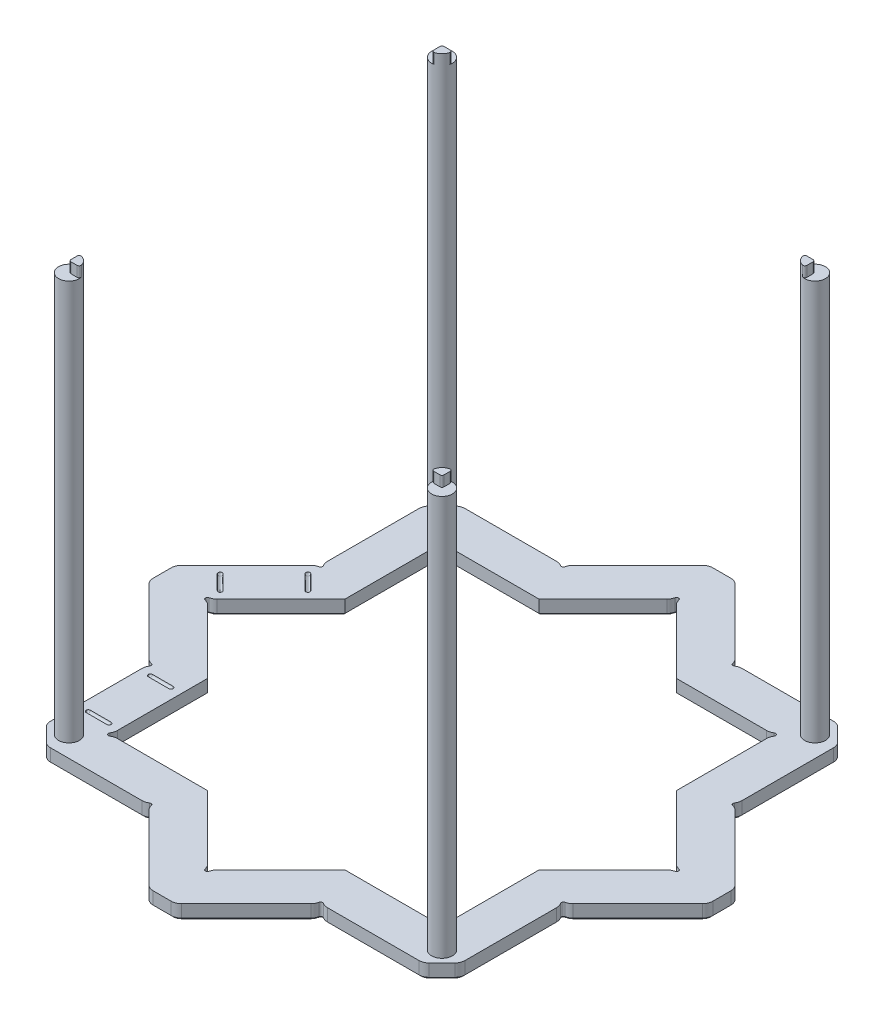
from build123d import *
from build123d.topology import SkipClean

# Parameters (mm, degrees)
SKETCH_1_W                       = 100
SKETCH_1_H                       = 100
EXTRUDE_1_DEPTH                  = 3.5
CUT_EXTRUDE_1_DEPTH              = 13.5
FILLET_1_R                       = 2.5
SKETCH_3_W                       = 80
SKETCH_3_H                       = 80
CUT_EXTRUDE_2_DEPTH              = 13.5
SKETCH_5_R                       = 0.5
CUT_EXTRUDE_3_DEPTH              = 13.5
FILLET_2_R                       = 2.5
SKETCH_13_R                      = 2.5
EXTRUDE_5_DEPTH                  = 96.5
EXTRUDE_6_DEPTH                  = 2.5
FILLET_7_R                       = 0.5
CUT_EXTRUDE_8_DEPTH              = 0.5
CUT_EXTRUDE_9_DEPTH              = 10
FILLET_8_R                       = 2.5
CHAMFER_1_SIZE                   = 0.5
SKETCH_19_W                      = 6
SKETCH_19_H                      = 1
CUT_EXTRUDE_10_DEPTH             = 0.5
FILLET_9_R                       = 0.5
SKETCH_20_R                      = 9.729268333
EXTRUDE_7_DEPTH                  = 10.5
PATTERN_CIRCULAR_1_COUNT         = 2
PATTERN_CIRCULAR_1_ANGLE         = 45
FILLET_9_OF_PATTERN_CIRCULAR_1_R = 0.5
SKETCH_21_R                      = 9.729268333
CUT_EXTRUDE_11_DEPTH             = 10.5


with BuildPart() as part:
    # 草图1 → 凸台-拉伸1 (new body)
    with BuildSketch(Plane(origin=(0, 0, 0), x_dir=(1, 0, 0), z_dir=(0, 1, 0))):
        Polygon((-20.710678119, 50), (20.710678119, 50), (0, 70.710678119), align=None)
        Polygon((20.710678119, 50), (50, 20.710678119), (50, 50), align=None)
        Polygon((50, -20.710678119), (70.710678119, 0), (50, 20.710678119), align=None)
        Polygon((0, -70.710678119), (20.710678119, -50), (-20.710678119, -50), align=None)
        Polygon((50, -50), (50, -20.710678119), (20.710678119, -50), align=None)
        Polygon((-50, -50), (-20.710678119, -50), (-50, -20.710678119), align=None)
        Polygon((-50, -20.710678119), (-50, 20.710678119), (-70.710678119, 0), align=None)
        Polygon((-50, 20.710678119), (-20.710678119, 50), (-50, 50), align=None)
        Polygon((0, -70.710678119), (-70.710678119, 0), (0, 70.710678119), (70.710678119, 0), align=None)
        Rectangle(SKETCH_1_W, SKETCH_1_H)
    extrude(amount=EXTRUDE_1_DEPTH)

    # 草图2 → 切除-拉伸1 (cut)
    with BuildSketch(Plane(origin=(0, 3.5, 0), x_dir=(1, 0, 0), z_dir=(0, 1, 0))):
        Polygon((45.45941546, 50), (50, 45.45941546), (50, 50), align=None)
        Polygon((-50, 50), (-50, 45.45941546), (-45.45941546, 50), align=None)
        Polygon((-50, -50), (-45.45941546, -50), (-50, -45.45941546), align=None)
        Polygon((50, -45.45941546), (45.45941546, -50), (50, -50), align=None)
        Polygon((67.5, 3.210678119), (67.5, -3.210678119), (70.710678119, 0), align=None)
        Polygon((0, -70.710678119), (3.210678119, -67.5), (-3.210678119, -67.5), align=None)
        Polygon((-70.710678119, 0), (-67.5, -3.210678119), (-67.5, 3.210678119), align=None)
        Polygon((-50, 50), (-50, 45.45941546), (-45.45941546, 50), align=None)
        Polygon((-50, -50), (-45.45941546, -50), (-50, -45.45941546), align=None)
        Polygon((-3.210678119, 67.5), (3.210678119, 67.5), (0, 70.710678119), align=None)
        Polygon((45.45941546, 50), (50, 45.45941546), (50, 50), align=None)
    extrude(amount=-CUT_EXTRUDE_1_DEPTH, mode=Mode.SUBTRACT)

    # 圆角1
    fillet_1_edges = [part.edges().sort_by_distance(p)[0] for p in [
        (50, 1.75, -45.45941546),
        (45.45941546, 1.75, -50),
        (-3.210678119, 1.75, -67.5),
        (3.210678119, 1.75, -67.5),
        (-45.45941546, 1.75, 50),
        (-50, 1.75, 45.45941546),
        (-45.45941546, 1.75, -50),
        (-50, 1.75, -45.45941546),
        (-67.5, 1.75, 3.210678119),
        (-67.5, 1.75, -3.210678119),
        (3.210678119, 1.75, 67.5),
        (-3.210678119, 1.75, 67.5),
        (67.5, 1.75, -3.210678119),
        (67.5, 1.75, 3.210678119),
        (45.45941546, 1.75, 50),
        (50, 1.75, 45.45941546),
    ]]
    fillet(fillet_1_edges, radius=FILLET_1_R)

    # 草图3 → 切除-拉伸2 (cut)
    with BuildSketch(Plane(origin=(0, 3.5, 0), x_dir=(1, 0, 0), z_dir=(0, 1, 0))):
        Rectangle(SKETCH_3_W, SKETCH_3_H)
        Polygon((56.568542495, 0), (0, 56.568542495), (-56.568542495, 0), (0, -56.568542495), align=None)
        Polygon((40, 16.568542495), (40, -16.568542495), (56.568542495, 0), align=None)
        Polygon((16.568542495, 40), (40, 16.568542495), (40, 40), align=None)
        Polygon((-16.568542495, 40), (16.568542495, 40), (0, 56.568542495), align=None)
        Polygon((-40, 40), (-40, 16.568542495), (-16.568542495, 40), align=None)
        Polygon((-56.568542495, 0), (-40, -16.568542495), (-40, 16.568542495), align=None)
        Polygon((-40, -40), (-16.568542495, -40), (-40, -16.568542495), align=None)
        Polygon((-16.568542495, -40), (0, -56.568542495), (16.568542495, -40), align=None)
        Polygon((40, -16.568542495), (16.568542495, -40), (40, -40), align=None)
    extrude(amount=-CUT_EXTRUDE_2_DEPTH, mode=Mode.SUBTRACT)

    # 草图5 → 切除-拉伸3 (cut)
    with BuildSketch(Plane(origin=(0, 3.5, 0), x_dir=(1, 0, 0), z_dir=(0, 1, 0))):
        with BuildLine():
            Line((40, -40), (39.5, -40))
            ThreePointArc((39.5, -40), (40, -40.5), (40.5, -40))
            ThreePointArc((40.5, -40), (40.353553391, -39.646446609), (40, -39.5))
            Line((40, -39.5), (40, -40))
        make_face()
        with BuildLine():
            ThreePointArc((-40, -39.5), (-40.353553391, -40.353553391), (-39.5, -40))
            Line((-39.5, -40), (-40, -40))
            Line((-40, -40), (-40, -39.5))
        make_face()
        with BuildLine():
            ThreePointArc((-39.5, 40), (-40.353553391, 40.353553391), (-40, 39.5))
            Line((-40, 39.5), (-40, 40))
            Line((-40, 40), (-39.5, 40))
        make_face()
        with BuildLine():
            Line((40, 40), (40, 39.5))
            ThreePointArc((40, 39.5), (40.353553391, 39.646446609), (40.5, 40))
            ThreePointArc((40.5, 40), (40, 40.5), (39.5, 40))
            Line((39.5, 40), (40, 40))
        make_face()
        with Locations((56.568542495, 0)):
            Circle(SKETCH_5_R)
        with Locations((0, -56.568542495)):
            Circle(SKETCH_5_R)
        with Locations((-56.568542495, 0)):
            Circle(SKETCH_5_R)
        with Locations((0, 56.568542495)):
            Circle(SKETCH_5_R)
    extrude(amount=-CUT_EXTRUDE_3_DEPTH, mode=Mode.SUBTRACT)

    # 圆角2
    fillet_2_edges = [part.edges().sort_by_distance(p)[0] for p in [
        (56.214989104, 1.75, 0.353553391),
        (40, 1.75, -39.5),
        (0.353553391, 1.75, -56.214989104),
        (-39.5, 1.75, -40),
        (-56.214989104, 1.75, -0.353553391),
        (-40, 1.75, 39.5),
        (-0.353553391, 1.75, 56.214989104),
        (39.5, 1.75, 40),
        (-39.5, 1.75, 40),
        (-40, 1.75, -39.5),
        (39.5, 1.75, -40),
        (56.214989104, 1.75, -0.353553391),
        (0.353553391, 1.75, 56.214989104),
        (-56.214989104, 1.75, 0.353553391),
        (-0.353553391, 1.75, -56.214989104),
        (40, 1.75, 39.5),
    ]]
    fillet(fillet_2_edges, radius=FILLET_2_R)

    # 草图13 → 凸台-拉伸5 (add)
    with BuildSketch(Plane(origin=(0, 3.5, 0), x_dir=(1, 0, 0), z_dir=(0, 1, 0))):
        with Locations(Location((-45, -45, 0), (0, 0, 270))):
            Circle(SKETCH_13_R)
        with Locations(Location((45, -45, 0), (0, 0, 270))):
            Circle(SKETCH_13_R)
        with Locations(Location((45, 45, 0), (0, 0, 270))):
            Circle(SKETCH_13_R)
        with Locations(Location((-45, 45, 0), (0, 0, 270))):
            Circle(SKETCH_13_R)
    extrude(amount=EXTRUDE_5_DEPTH)

    # 草图14 → 凸台-拉伸6 (add)
    with SkipClean():  # the faces are left unmerged after this step: merging them gives an invalid solid
        with BuildSketch(Plane(origin=(0, 100, 0), x_dir=(1, 0, 0), z_dir=(0, 1, 0))):
            with BuildLine():
                ThreePointArc((-45, 42.5), (-43.232233047, 43.232233047), (-42.5, 45))
                Line((-42.5, 45), (-45, 45))
                Line((-45, 45), (-45, 42.5))
            make_face()
            with BuildLine():
                Line((45, 45), (42.5, 45))
                ThreePointArc((42.5, 45), (43.232233047, 43.232233047), (45, 42.5))
                Line((45, 42.5), (45, 45))
            make_face()
            with BuildLine():
                ThreePointArc((-42.5, -45), (-43.232233047, -43.232233047), (-45, -42.5))
                Line((-45, -42.5), (-45, -45))
                Line((-45, -45), (-42.5, -45))
            make_face()
            with BuildLine():
                Line((45, -45), (45, -42.5))
                ThreePointArc((45, -42.5), (43.232233047, -43.232233047), (42.5, -45))
                Line((42.5, -45), (45, -45))
            make_face()
        extrude(amount=EXTRUDE_6_DEPTH)

    # 圆角7
    # the kernel refuses this fillet: 0.5 mm, written as the material it takes off along each edge
    with BuildSketch(Plane(origin=(45, 100, 45), x_dir=(-1, 0, 0), z_dir=(0, 1, 0)), Plane(origin=(-45, 100, 45), x_dir=(0, 0, -1), z_dir=(0, 1, 0)), Plane(origin=(-45, 100, -45), x_dir=(1, 0, 0), z_dir=(0, 1, 0))) as fillet_7_piece_1:
        with BuildLine():
            CenterArc((FILLET_7_R, -FILLET_7_R), FILLET_7_R, 90, 90)
            Line((0, -FILLET_7_R), (0, 0))
            Line((0, 0), (FILLET_7_R, 0))
        make_face()
    extrude(amount=3.75, mode=Mode.SUBTRACT)
    with BuildSketch(Plane(origin=(45, 100, 42.5), x_dir=(-0.992029696267168, 0, 0.12600429248271836), z_dir=(0, 1, 0)), Plane(origin=(-42.5, 100, 45), x_dir=(-0.12600429248272402, 0, -0.9920296962671673), z_dir=(0, 1, 0)), Plane(origin=(-45, 100, -42.5), x_dir=(0.992029696267167, 0, -0.12600429248272682), z_dir=(0, 1, 0)), Plane(origin=(42.5, 100, -45), x_dir=(0.12600429248273368, 0, 0.992029696267166), z_dir=(0, 1, 0))) as fillet_7_piece_2:
        with BuildLine():
            CenterArc((0.567019316, 0.496014848), FILLET_7_R, 172.761243907, 104.477512186)
            Line((0.071004468, 0.559016994), (0, 0))
            ThreePointArc((0, 0), (0.315010731, -0.019925759), (0.630021462, 0))
        make_face()
    extrude(amount=4.075053656, mode=Mode.SUBTRACT)
    with BuildSketch(Plane(origin=(42.5, 100, 45), x_dir=(0.1260042924827351, 0, -0.9920296962671659), z_dir=(0, 1, 0)), Plane(origin=(-45, 100, 42.5), x_dir=(0.992029696267167, 0, 0.12600429248272682), z_dir=(0, 1, 0)), Plane(origin=(-42.5, 100, -45), x_dir=(-0.12600429248272402, 0, 0.9920296962671673), z_dir=(0, 1, 0)), Plane(origin=(45, 100, -42.5), x_dir=(-0.9920296962671677, 0, -0.12600429248271977), z_dir=(0, 1, 0))) as fillet_7_piece_3:
        with BuildLine():
            CenterArc((0.567019316, -0.496014848), FILLET_7_R, 82.761243907, 104.477512186)
            Line((0.071004468, -0.559016994), (0, 0))
            ThreePointArc((0, 0), (0.315010731, 0.019925759), (0.630021462, 0))
        make_face()
    extrude(amount=4.075053656, mode=Mode.SUBTRACT)
    with BuildSketch(Plane(origin=(45, 100, -45), x_dir=(-1, 0, 0), z_dir=(0, 1, 0))) as fillet_7_piece_4:
        with BuildLine():
            CenterArc((FILLET_7_R, FILLET_7_R), FILLET_7_R, 180, 90)
            Line((0, FILLET_7_R), (0, 0))
            Line((0, 0), (FILLET_7_R, 0))
        make_face()
    extrude(amount=3.75, mode=Mode.SUBTRACT)

    # 草图15 → 切除-拉伸8 (cut)
    with BuildSketch(Plane.XZ):
        with BuildLine():
            ThreePointArc((42.5, 45), (42.512659617, 44.748727595), (42.550510257, 44.5))
            Line((42.550510257, 44.5), (44.5, 44.5))
            Line((44.5, 44.5), (44.5, 42.550510257))
            ThreePointArc((44.5, 42.550510257), (44.748727595, 42.512659617), (45, 42.5))
            Line((45, 42.5), (45, 45))
            Line((45, 45), (42.5, 45))
        make_face()
        with BuildLine():
            Line((44.5, -44.5), (42.550510257, -44.5))
            ThreePointArc((42.550510257, -44.5), (42.512659617, -44.748727595), (42.5, -45))
            Line((42.5, -45), (45, -45))
            Line((45, -45), (45, -42.5))
            ThreePointArc((45, -42.5), (44.748727595, -42.512659617), (44.5, -42.550510257))
            Line((44.5, -42.550510257), (44.5, -44.5))
        make_face()
        with BuildLine():
            Line((-42.550510257, -44.5), (-44.5, -44.5))
            Line((-44.5, -44.5), (-44.5, -42.550510257))
            ThreePointArc((-44.5, -42.550510257), (-44.748727595, -42.512659617), (-45, -42.5))
            Line((-45, -42.5), (-45, -45))
            Line((-45, -45), (-42.5, -45))
            ThreePointArc((-42.5, -45), (-42.512659617, -44.748727595), (-42.550510257, -44.5))
        make_face()
        with BuildLine():
            ThreePointArc((-45, 42.5), (-44.748727595, 42.512659617), (-44.5, 42.550510257))
            Line((-44.5, 42.550510257), (-44.5, 44.5))
            Line((-44.5, 44.5), (-42.550510257, 44.5))
            ThreePointArc((-42.550510257, 44.5), (-42.512659617, 44.748727595), (-42.5, 45))
            Line((-42.5, 45), (-45, 45))
            Line((-45, 45), (-45, 42.5))
        make_face()
    extrude(amount=-CUT_EXTRUDE_8_DEPTH, mode=Mode.SUBTRACT)

    # 草图18 → 切除-拉伸9 (cut)
    with BuildSketch(Plane(origin=(0, 3.5, 0), x_dir=(1, 0, 0), z_dir=(0, 1, 0))):
        with BuildLine():
            ThreePointArc((50.5, 20.710678119), (50.353553391, 21.064231509), (50, 21.210678119))
            Line((50, 21.210678119), (50, 20.710678119))
            Line((50, 20.710678119), (50.353553391, 20.357124728))
            ThreePointArc((50.353553391, 20.357124728), (50.461939766, 20.519336402), (50.5, 20.710678119))
        make_face()
        with BuildLine():
            Line((50, 20.710678119), (50, 21.210678119))
            ThreePointArc((50, 21.210678119), (49.538060234, 20.519336402), (50.353553391, 20.357124728))
            Line((50.353553391, 20.357124728), (50, 20.710678119))
        make_face()
        with BuildLine():
            ThreePointArc((50.5, -20.710678119), (50.461939766, -20.519336402), (50.353553391, -20.357124728))
            Line((50.353553391, -20.357124728), (50, -20.710678119))
            Line((50, -20.710678119), (50, -21.210678119))
            ThreePointArc((50, -21.210678119), (50.353553391, -21.064231509), (50.5, -20.710678119))
        make_face()
        with BuildLine():
            Line((50, -20.710678119), (50.353553391, -20.357124728))
            ThreePointArc((50.353553391, -20.357124728), (49.538060234, -20.519336402), (50, -21.210678119))
            Line((50, -21.210678119), (50, -20.710678119))
        make_face()
        with BuildLine():
            ThreePointArc((20.357124728, -50.353553391), (20.902019835, -50.461939766), (21.210678119, -50))
            Line((21.210678119, -50), (20.710678119, -50))
            Line((20.710678119, -50), (20.357124728, -50.353553391))
        make_face()
        with BuildLine():
            Line((20.710678119, -50), (21.210678119, -50))
            ThreePointArc((21.210678119, -50), (20.519336402, -49.538060234), (20.357124728, -50.353553391))
            Line((20.357124728, -50.353553391), (20.710678119, -50))
        make_face()
        with BuildLine():
            ThreePointArc((-20.210678119, -50), (-20.710678119, -49.5), (-21.210678119, -50))
            Line((-21.210678119, -50), (-20.710678119, -50))
            Line((-20.710678119, -50), (-20.357124728, -50.353553391))
            ThreePointArc((-20.357124728, -50.353553391), (-20.248738352, -50.191341716), (-20.210678119, -50))
        make_face()
        with BuildLine():
            Line((-20.710678119, -50), (-21.210678119, -50))
            ThreePointArc((-21.210678119, -50), (-20.902019835, -50.461939766), (-20.357124728, -50.353553391))
            Line((-20.357124728, -50.353553391), (-20.710678119, -50))
        make_face()
        with BuildLine():
            ThreePointArc((-49.5, -20.710678119), (-49.808658284, -20.248738352), (-50.353553391, -20.357124728))
            Line((-50.353553391, -20.357124728), (-50, -20.710678119))
            Line((-50, -20.710678119), (-50, -21.210678119))
            ThreePointArc((-50, -21.210678119), (-49.646446609, -21.064231509), (-49.5, -20.710678119))
        make_face()
        with BuildLine():
            Line((-50, -20.710678119), (-50.353553391, -20.357124728))
            ThreePointArc((-50.353553391, -20.357124728), (-50.461939766, -20.902019835), (-50, -21.210678119))
            Line((-50, -21.210678119), (-50, -20.710678119))
        make_face()
        with BuildLine():
            ThreePointArc((-49.5, 20.710678119), (-49.646446609, 21.064231509), (-50, 21.210678119))
            Line((-50, 21.210678119), (-50, 20.710678119))
            Line((-50, 20.710678119), (-50.353553391, 20.357124728))
            ThreePointArc((-50.353553391, 20.357124728), (-49.808658284, 20.248738352), (-49.5, 20.710678119))
        make_face()
        with BuildLine():
            Line((-50, 20.710678119), (-50, 21.210678119))
            ThreePointArc((-50, 21.210678119), (-50.461939766, 20.902019835), (-50.353553391, 20.357124728))
            Line((-50.353553391, 20.357124728), (-50, 20.710678119))
        make_face()
        with BuildLine():
            ThreePointArc((-20.210678119, 50), (-20.248738352, 50.191341716), (-20.357124728, 50.353553391))
            Line((-20.357124728, 50.353553391), (-20.710678119, 50))
            Line((-20.710678119, 50), (-21.210678119, 50))
            ThreePointArc((-21.210678119, 50), (-20.710678119, 49.5), (-20.210678119, 50))
        make_face()
        with BuildLine():
            Line((-20.710678119, 50), (-20.357124728, 50.353553391))
            ThreePointArc((-20.357124728, 50.353553391), (-20.902019835, 50.461939766), (-21.210678119, 50))
            Line((-21.210678119, 50), (-20.710678119, 50))
        make_face()
        with BuildLine():
            Line((21.210678119, 50), (20.710678119, 50))
            Line((20.710678119, 50), (20.357124728, 50.353553391))
            ThreePointArc((20.357124728, 50.353553391), (20.519336402, 49.538060234), (21.210678119, 50))
        make_face()
        with BuildLine():
            Line((20.357124728, 50.353553391), (20.710678119, 50))
            Line((20.710678119, 50), (21.210678119, 50))
            ThreePointArc((21.210678119, 50), (20.902019835, 50.461939766), (20.357124728, 50.353553391))
        make_face()
    extrude(amount=-CUT_EXTRUDE_9_DEPTH, mode=Mode.SUBTRACT)

    # 圆角8
    fillet_8_edges = [part.edges().sort_by_distance(p)[0] for p in [
        (21.210678119, 1.75, -50),
        (50, 1.75, -21.210678119),
        (50.353553391, 1.75, 20.357124728),
        (20.357124728, 1.75, 50.353553391),
        (-20.357124728, 1.75, 50.353553391),
        (-50, 1.75, 21.210678119),
        (-50.353553391, 1.75, -20.357124728),
        (-21.210678119, 1.75, -50),
        (20.357124728, 1.75, -50.353553391),
        (-20.357124728, 1.75, -50.353553391),
        (-50, 1.75, -21.210678119),
        (-50.353553391, 1.75, 20.357124728),
        (-21.210678119, 1.75, 50),
        (21.210678119, 1.75, 50),
        (50, 1.75, 21.210678119),
        (50.353553391, 1.75, -20.357124728),
    ]]
    fillet(fillet_8_edges, radius=FILLET_8_R)

    # 倒角1
    chamfer_1_edges = [part.edges().sort_by_distance(p)[0] for p in [
        (49.538060234, 0, -20.519336402),
        (11.740492672, 0, -58.970185446),
        (20.519336402, 0, -49.538060234),
        (33.396436034, 0, -50),
        (49.538060234, 0, 20.519336402),
        (50, 0, 33.396436034),
        (33.396436034, 0, 50),
        (20.519336402, 0, 49.538060234),
        (11.740492672, 0, 58.970185446),
        (-20.519336402, 0, 49.538060234),
        (-50, 0, 33.396436034),
        (-49.538060234, 0, 20.519336402),
        (-58.970185446, 0, 11.740492672),
        (-58.970185446, 0, -11.740492672),
        (-49.538060234, 0, -20.519336402),
        (-20.519336402, 0, -49.538060234),
        (50.587034625, 0, 19.97312559),
        (49.893567769, 0, 21.647302677),
        (21.647302677, 0, 49.893567769),
        (19.97312559, 0, 50.587034625),
        (-19.97312559, 0, 50.587034625),
        (-21.647302677, 0, 49.893567769),
        (-49.893567769, 0, 21.647302677),
        (-50.587034625, 0, 19.97312559),
        (-49.893567769, 0, -21.647302677),
        (-50.587034625, 0, -19.97312559),
        (-21.647302677, 0, -49.893567769),
        (-19.97312559, 0, -50.587034625),
        (19.97312559, 0, -50.587034625),
        (21.647302677, 0, -49.893567769),
        (49.893567769, 0, -21.647302677),
        (50.587034625, 0, -19.97312559),
        (0, 0, -67.5),
        (47.72970773, 0, -47.72970773),
        (50, 0, -33.396436034),
        (58.970185446, 0, -11.740492672),
        (67.5, 0, 0),
        (58.970185446, 0, 11.740492672),
        (47.72970773, 0, 47.72970773),
        (0, 0, 67.5),
        (-11.740492672, 0, 58.970185446),
        (-33.396436034, 0, 50),
        (-47.72970773, 0, 47.72970773),
        (-67.5, 0, 0),
        (-50, 0, -33.396436034),
        (-47.72970773, 0, -47.72970773),
        (-33.396436034, 0, -50),
        (-11.740492672, 0, -58.970185446),
        (-45.380590135, 0, -49.809698831),
        (-49.809698831, 0, -45.380590135),
        (-45.380590135, 0, 49.809698831),
        (-49.809698831, 0, 45.380590135),
        (49.809698831, 0, 45.380590135),
        (45.380590135, 0, 49.809698831),
        (49.809698831, 0, -45.380590135),
        (45.380590135, 0, -49.809698831),
        (67.309698831, 0, -3.131852794),
        (67.309698831, 0, 3.131852794),
        (3.131852794, 0, 67.309698831),
        (-3.131852794, 0, 67.309698831),
        (-67.309698831, 0, 3.131852794),
        (-67.309698831, 0, -3.131852794),
        (-3.131852794, 0, -67.309698831),
        (3.131852794, 0, -67.309698831),
        (47.697969277, 0, 8.870573217),
        (40, 0, -27.45511505),
        (8.870573217, 0, -47.697969277),
        (-27.45511505, 0, -40),
        (-40, 0, -27.45511505),
        (-47.697969277, 0, -8.870573217),
        (-27.45511505, 0, 40),
        (-8.870573217, 0, 47.697969277),
        (-40, 0, 27.45511505),
        (-40.353553391, 0, 40.353553391),
        (0, 0, 57.068542495),
        (8.870573217, 0, 47.697969277),
        (27.45511505, 0, 40),
        (40.353553391, 0, 40.353553391),
        (40, 0, 27.45511505),
        (57.068542495, 0, 0),
        (47.697969277, 0, -8.870573217),
        (40.353553391, 0, -40.353553391),
        (27.45511505, 0, -40),
        (0, 0, -57.068542495),
        (-8.870573217, 0, -47.697969277),
        (-40.353553391, 0, -40.353553391),
        (-57.068542495, 0, 0),
        (-47.697969277, 0, 8.870573217),
        (40.106432231, 0, 39.063375441),
        (39.063375441, 0, 40.106432231),
        (40.106432231, 0, -39.063375441),
        (39.063375441, 0, -40.106432231),
        (-39.063375441, 0, -40.106432231),
        (-40.106432231, 0, -39.063375441),
        (-39.063375441, 0, 40.106432231),
        (-40.106432231, 0, 39.063375441),
        (0.737552529, 0, 55.98150787),
        (-0.737552529, 0, 55.98150787),
        (-0.737552529, 0, -55.98150787),
        (0.737552529, 0, -55.98150787),
        (55.98150787, 0, -0.737552529),
        (55.98150787, 0, 0.737552529),
        (-55.98150787, 0, 0.737552529),
        (-55.98150787, 0, -0.737552529),
    ]]
    chamfer(chamfer_1_edges, length=CHAMFER_1_SIZE)

    # 草图19 → 切除-拉伸10 (cut)
    with BuildSketch(Plane(origin=(0, 3.5, 0), x_dir=(1, 0, 0), z_dir=(0, 1, 0))):
        with Locations((-45, -37.841687605)):
            Rectangle(SKETCH_19_W, SKETCH_19_H)
        with Locations((-45, -22.868990514)):
            Rectangle(SKETCH_19_W, SKETCH_19_H)
    cut_extrude_10 = extrude(amount=-CUT_EXTRUDE_10_DEPTH, mode=Mode.SUBTRACT)

    # 圆角9
    # the kernel refuses this fillet: 0.5 mm, written as the material it adds along each edge
    with BuildSketch(Plane(origin=(-47.5, 3.5, 37.841687605), x_dir=(0, 0, -1), z_dir=(0, -1, 0))) as fillet_9_piece_1_section:
        Polygon((0, 0), (FILLET_9_R, 0), (FILLET_9_R, -FILLET_9_R), (0, -FILLET_9_R), align=None)
    fillet_9_piece_1 = extrude(amount=FILLET_9_R, mode=Mode.PRIVATE)
    fillet_9_piece_1 = fillet_9_piece_1 - Plane(origin=(-47.5, 3.5, 37.841687605), x_dir=(0.7071067811865475, 0, 0.7071067811865475), z_dir=(0, -1, 0)) * Sphere(FILLET_9_R, mode=Mode.PRIVATE)
    add(fillet_9_piece_1)
    with BuildSketch(Plane(origin=(-42.5, 3.5, 37.841687605), x_dir=(0, -1, 0), z_dir=(1, 0, 0))) as fillet_9_piece_2_section:
        Polygon((0, 0), (FILLET_9_R, 0), (FILLET_9_R, FILLET_9_R), (0, FILLET_9_R), align=None)
    fillet_9_piece_2 = extrude(amount=FILLET_9_R, mode=Mode.PRIVATE)
    fillet_9_piece_2 = fillet_9_piece_2 - Plane(origin=(-42.5, 3.5, 37.841687605), x_dir=(0, 0.7071067811865475, 0.7071067811865475), z_dir=(1, 0, 0)) * Sphere(FILLET_9_R, mode=Mode.PRIVATE)
    add(fillet_9_piece_2)
    with BuildSketch(Plane(origin=(-47.5, 3.5, 37.841687605), x_dir=(0, -1, 0), z_dir=(0, 0, 1))) as fillet_9_piece_3_section:
        Polygon((0, 0), (FILLET_9_R, 0), (FILLET_9_R, -FILLET_9_R), (0, -FILLET_9_R), align=None)
    fillet_9_piece_3 = extrude(amount=FILLET_9_R, mode=Mode.PRIVATE)
    fillet_9_piece_3 = fillet_9_piece_3 - Plane(origin=(-47.5, 3.5, 37.841687605), x_dir=(0.7071067811865475, 0.7071067811865475, 0), z_dir=(0, 0, 1)) * Sphere(FILLET_9_R, mode=Mode.PRIVATE)
    add(fillet_9_piece_3)
    with BuildSketch(Plane(origin=(-42.5, 3.5, 37.841687605), x_dir=(1, 0, 0), z_dir=(0, 0, 1))) as fillet_9_piece_4_section:
        Polygon((0, 0), (FILLET_9_R, 0), (FILLET_9_R, -FILLET_9_R), (0, -FILLET_9_R), align=None)
    fillet_9_piece_4 = extrude(amount=FILLET_9_R, mode=Mode.PRIVATE)
    fillet_9_piece_4 = fillet_9_piece_4 - Plane(origin=(-42.5, 3.5, 37.841687605), x_dir=(-0.7071067811865475, 0.7071067811865475, 0), z_dir=(0, 0, 1)) * Sphere(FILLET_9_R, mode=Mode.PRIVATE)
    add(fillet_9_piece_4)
    with BuildSketch(Plane(origin=(-47.5, 3.5, 22.868990514), x_dir=(-1, 0, 0), z_dir=(0, 0, -1))) as fillet_9_piece_5_section:
        Polygon((0, 0), (FILLET_9_R, 0), (FILLET_9_R, -FILLET_9_R), (0, -FILLET_9_R), align=None)
    fillet_9_piece_5 = extrude(amount=FILLET_9_R, mode=Mode.PRIVATE)
    fillet_9_piece_5 = fillet_9_piece_5 - Plane(origin=(-47.5, 3.5, 22.868990514), x_dir=(0.7071067811865475, 0.7071067811865475, 0), z_dir=(0, 0, -1)) * Sphere(FILLET_9_R, mode=Mode.PRIVATE)
    add(fillet_9_piece_5)
    with BuildSketch(Plane(origin=(-42.5, 3.5, 22.868990514), x_dir=(0, -1, 0), z_dir=(0, 0, -1))) as fillet_9_piece_6_section:
        Polygon((0, 0), (FILLET_9_R, 0), (FILLET_9_R, -FILLET_9_R), (0, -FILLET_9_R), align=None)
    fillet_9_piece_6 = extrude(amount=FILLET_9_R, mode=Mode.PRIVATE)
    fillet_9_piece_6 = fillet_9_piece_6 - Plane(origin=(-42.5, 3.5, 22.868990514), x_dir=(-0.7071067811865475, 0.7071067811865475, 0), z_dir=(0, 0, -1)) * Sphere(FILLET_9_R, mode=Mode.PRIVATE)
    add(fillet_9_piece_6)
    with BuildSketch(Plane(origin=(-47.5, 3.5, 22.868990514), x_dir=(0, -1, 0), z_dir=(-1, 0, 0))) as fillet_9_piece_7_section:
        Polygon((0, 0), (FILLET_9_R, 0), (FILLET_9_R, FILLET_9_R), (0, FILLET_9_R), align=None)
    fillet_9_piece_7 = extrude(amount=FILLET_9_R, mode=Mode.PRIVATE)
    fillet_9_piece_7 = fillet_9_piece_7 - Plane(origin=(-47.5, 3.5, 22.868990514), x_dir=(0, 0.7071067811865475, -0.7071067811865475), z_dir=(-1, 0, 0)) * Sphere(FILLET_9_R, mode=Mode.PRIVATE)
    add(fillet_9_piece_7)
    with BuildSketch(Plane(origin=(-42.5, 3.5, 22.868990514), x_dir=(0, 0, 1), z_dir=(0, -1, 0))) as fillet_9_piece_8_section:
        Polygon((0, 0), (FILLET_9_R, 0), (FILLET_9_R, -FILLET_9_R), (0, -FILLET_9_R), align=None)
    fillet_9_piece_8 = extrude(amount=FILLET_9_R, mode=Mode.PRIVATE)
    fillet_9_piece_8 = fillet_9_piece_8 - Plane(origin=(-42.5, 3.5, 22.868990514), x_dir=(-0.7071067811865475, 0, -0.7071067811865475), z_dir=(0, -1, 0)) * Sphere(FILLET_9_R, mode=Mode.PRIVATE)
    add(fillet_9_piece_8)
    with BuildSketch(Plane(origin=(-47.5, 3, 38.341687605), x_dir=(0, 1, 0), z_dir=(1, 0, 0)), Plane(origin=(-42.5, 3, 37.341687605), x_dir=(0, 1, 0), z_dir=(-1, 0, 0)), Plane(origin=(-47.5, 3, 23.368990514), x_dir=(0, 1, 0), z_dir=(1, 0, 0)), Plane(origin=(-42.5, 3, 22.368990514), x_dir=(0, 1, 0), z_dir=(-1, 0, 0))) as fillet_9_piece_9:
        with BuildLine():
            CenterArc((FILLET_9_R, -FILLET_9_R), FILLET_9_R, 90, 90)
            Line((0, -FILLET_9_R), (0, 0))
            Line((0, 0), (FILLET_9_R, 0))
        make_face()
    extrude(amount=5)

    # 阵列(圆周)1: 切除-拉伸10 ×2 about axis
    pattern_circular_1_axis = Axis((0, 14, 0), (0, -1, 0))
    for i in range(1, PATTERN_CIRCULAR_1_COUNT):
        add(cut_extrude_10.rotate(pattern_circular_1_axis, i * PATTERN_CIRCULAR_1_ANGLE / (PATTERN_CIRCULAR_1_COUNT - 1)), mode=Mode.SUBTRACT)

    # 圆角9 of 阵列(圆周)1
    # the kernel refuses this fillet: 0.5 mm, written as the material it adds along each edge
    with BuildSketch(Plane(origin=(-60.345686023, 3.5, -6.829458189), x_dir=(0, -1, 0), z_dir=(-0.7071067811865462, 0, -0.7071067811865488))) as fillet_9_of_pattern_circular_1_piece_1_section:
        Polygon((0, 0), (FILLET_9_OF_PATTERN_CIRCULAR_1_R, 0), (FILLET_9_OF_PATTERN_CIRCULAR_1_R, -FILLET_9_OF_PATTERN_CIRCULAR_1_R), (0, -FILLET_9_OF_PATTERN_CIRCULAR_1_R), align=None)
    fillet_9_of_pattern_circular_1_piece_1 = extrude(amount=FILLET_9_OF_PATTERN_CIRCULAR_1_R, mode=Mode.PRIVATE)
    fillet_9_of_pattern_circular_1_piece_1 = fillet_9_of_pattern_circular_1_piece_1 - Plane(origin=(-60.345686023, 3.5, -6.829458189), x_dir=(-0.5000000000000009, 0.7071067811865475, 0.49999999999999906), z_dir=(-0.7071067811865462, 0, -0.7071067811865488)) * Sphere(FILLET_9_OF_PATTERN_CIRCULAR_1_R, mode=Mode.PRIVATE)
    add(fillet_9_of_pattern_circular_1_piece_1)
    with BuildSketch(Plane(origin=(-56.810152117, 3.5, -3.293924284), x_dir=(0, -1, 0), z_dir=(0.7071067811865462, 0, 0.7071067811865488))) as fillet_9_of_pattern_circular_1_piece_2_section:
        Polygon((0, 0), (FILLET_9_OF_PATTERN_CIRCULAR_1_R, 0), (FILLET_9_OF_PATTERN_CIRCULAR_1_R, FILLET_9_OF_PATTERN_CIRCULAR_1_R), (0, FILLET_9_OF_PATTERN_CIRCULAR_1_R), align=None)
    fillet_9_of_pattern_circular_1_piece_2 = extrude(amount=FILLET_9_OF_PATTERN_CIRCULAR_1_R, mode=Mode.PRIVATE)
    fillet_9_of_pattern_circular_1_piece_2 = fillet_9_of_pattern_circular_1_piece_2 - Plane(origin=(-56.810152117, 3.5, -3.293924284), x_dir=(-0.5000000000000009, 0.7071067811865475, 0.49999999999999906), z_dir=(0.7071067811865462, 0, 0.7071067811865488)) * Sphere(FILLET_9_OF_PATTERN_CIRCULAR_1_R, mode=Mode.PRIVATE)
    add(fillet_9_of_pattern_circular_1_piece_2)
    with BuildSketch(Plane(origin=(-60.345686023, 3.5, -6.829458189), x_dir=(-0.7071067811865488, 0, 0.7071067811865462), z_dir=(-0.7071067811865462, 0, -0.7071067811865488))) as fillet_9_of_pattern_circular_1_piece_3_section:
        Polygon((0, 0), (FILLET_9_OF_PATTERN_CIRCULAR_1_R, 0), (FILLET_9_OF_PATTERN_CIRCULAR_1_R, -FILLET_9_OF_PATTERN_CIRCULAR_1_R), (0, -FILLET_9_OF_PATTERN_CIRCULAR_1_R), align=None)
    fillet_9_of_pattern_circular_1_piece_3 = extrude(amount=FILLET_9_OF_PATTERN_CIRCULAR_1_R, mode=Mode.PRIVATE)
    fillet_9_of_pattern_circular_1_piece_3 = fillet_9_of_pattern_circular_1_piece_3 - Plane(origin=(-60.345686023, 3.5, -6.829458189), x_dir=(0.5000000000000009, 0.7071067811865475, -0.49999999999999906), z_dir=(-0.7071067811865462, 0, -0.7071067811865488)) * Sphere(FILLET_9_OF_PATTERN_CIRCULAR_1_R, mode=Mode.PRIVATE)
    add(fillet_9_of_pattern_circular_1_piece_3)
    with BuildSketch(Plane(origin=(-56.810152117, 3.5, -3.293924284), x_dir=(0, -1, 0), z_dir=(-0.7071067811865488, 0, 0.7071067811865462))) as fillet_9_of_pattern_circular_1_piece_4_section:
        Polygon((0, 0), (FILLET_9_OF_PATTERN_CIRCULAR_1_R, 0), (FILLET_9_OF_PATTERN_CIRCULAR_1_R, FILLET_9_OF_PATTERN_CIRCULAR_1_R), (0, FILLET_9_OF_PATTERN_CIRCULAR_1_R), align=None)
    fillet_9_of_pattern_circular_1_piece_4 = extrude(amount=FILLET_9_OF_PATTERN_CIRCULAR_1_R, mode=Mode.PRIVATE)
    fillet_9_of_pattern_circular_1_piece_4 = fillet_9_of_pattern_circular_1_piece_4 - Plane(origin=(-56.810152117, 3.5, -3.293924284), x_dir=(-0.49999999999999906, 0.7071067811865475, -0.5000000000000009), z_dir=(-0.7071067811865488, 0, 0.7071067811865462)) * Sphere(FILLET_9_OF_PATTERN_CIRCULAR_1_R, mode=Mode.PRIVATE)
    add(fillet_9_of_pattern_circular_1_piece_4)
    with BuildSketch(Plane(origin=(-49.758390378, 3.5, -17.416753835), x_dir=(-0.7071067811865462, 0, -0.7071067811865488), z_dir=(0.7071067811865488, 0, -0.7071067811865462))) as fillet_9_of_pattern_circular_1_piece_5_section:
        Polygon((0, 0), (FILLET_9_OF_PATTERN_CIRCULAR_1_R, 0), (FILLET_9_OF_PATTERN_CIRCULAR_1_R, -FILLET_9_OF_PATTERN_CIRCULAR_1_R), (0, -FILLET_9_OF_PATTERN_CIRCULAR_1_R), align=None)
    fillet_9_of_pattern_circular_1_piece_5 = extrude(amount=FILLET_9_OF_PATTERN_CIRCULAR_1_R, mode=Mode.PRIVATE)
    fillet_9_of_pattern_circular_1_piece_5 = fillet_9_of_pattern_circular_1_piece_5 - Plane(origin=(-49.758390378, 3.5, -17.416753835), x_dir=(0.49999999999999906, 0.7071067811865475, 0.5000000000000009), z_dir=(0.7071067811865488, 0, -0.7071067811865462)) * Sphere(FILLET_9_OF_PATTERN_CIRCULAR_1_R, mode=Mode.PRIVATE)
    add(fillet_9_of_pattern_circular_1_piece_5)
    with BuildSketch(Plane(origin=(-46.222856472, 3.5, -13.881219929), x_dir=(0.7071067811865462, 0, 0.7071067811865488), z_dir=(0.7071067811865488, 0, -0.7071067811865462))) as fillet_9_of_pattern_circular_1_piece_6_section:
        Polygon((0, 0), (FILLET_9_OF_PATTERN_CIRCULAR_1_R, 0), (FILLET_9_OF_PATTERN_CIRCULAR_1_R, FILLET_9_OF_PATTERN_CIRCULAR_1_R), (0, FILLET_9_OF_PATTERN_CIRCULAR_1_R), align=None)
    fillet_9_of_pattern_circular_1_piece_6 = extrude(amount=FILLET_9_OF_PATTERN_CIRCULAR_1_R, mode=Mode.PRIVATE)
    fillet_9_of_pattern_circular_1_piece_6 = fillet_9_of_pattern_circular_1_piece_6 - Plane(origin=(-46.222856472, 3.5, -13.881219929), x_dir=(-0.49999999999999906, 0.7071067811865475, -0.5000000000000009), z_dir=(0.7071067811865488, 0, -0.7071067811865462)) * Sphere(FILLET_9_OF_PATTERN_CIRCULAR_1_R, mode=Mode.PRIVATE)
    add(fillet_9_of_pattern_circular_1_piece_6)
    with BuildSketch(Plane(origin=(-49.758390378, 3.5, -17.416753835), x_dir=(-0.7071067811865462, 0, -0.7071067811865488), z_dir=(0, -1, 0))) as fillet_9_of_pattern_circular_1_piece_7_section:
        Polygon((0, 0), (FILLET_9_OF_PATTERN_CIRCULAR_1_R, 0), (FILLET_9_OF_PATTERN_CIRCULAR_1_R, -FILLET_9_OF_PATTERN_CIRCULAR_1_R), (0, -FILLET_9_OF_PATTERN_CIRCULAR_1_R), align=None)
    fillet_9_of_pattern_circular_1_piece_7 = extrude(amount=FILLET_9_OF_PATTERN_CIRCULAR_1_R, mode=Mode.PRIVATE)
    fillet_9_of_pattern_circular_1_piece_7 = fillet_9_of_pattern_circular_1_piece_7 - Plane(origin=(-49.758390378, 3.5, -17.416753835), x_dir=(1, 0, 0), z_dir=(0, -1, 0)) * Sphere(FILLET_9_OF_PATTERN_CIRCULAR_1_R, mode=Mode.PRIVATE)
    add(fillet_9_of_pattern_circular_1_piece_7)
    with BuildSketch(Plane(origin=(-46.222856472, 3.5, -13.881219929), x_dir=(-0.7071067811865488, 0, 0.7071067811865462), z_dir=(0, -1, 0))) as fillet_9_of_pattern_circular_1_piece_8_section:
        Polygon((0, 0), (FILLET_9_OF_PATTERN_CIRCULAR_1_R, 0), (FILLET_9_OF_PATTERN_CIRCULAR_1_R, -FILLET_9_OF_PATTERN_CIRCULAR_1_R), (0, -FILLET_9_OF_PATTERN_CIRCULAR_1_R), align=None)
    fillet_9_of_pattern_circular_1_piece_8 = extrude(amount=FILLET_9_OF_PATTERN_CIRCULAR_1_R, mode=Mode.PRIVATE)
    fillet_9_of_pattern_circular_1_piece_8 = fillet_9_of_pattern_circular_1_piece_8 - Plane(origin=(-46.222856472, 3.5, -13.881219929), x_dir=(0, 0, -1), z_dir=(0, -1, 0)) * Sphere(FILLET_9_OF_PATTERN_CIRCULAR_1_R, mode=Mode.PRIVATE)
    add(fillet_9_of_pattern_circular_1_piece_8)
    with BuildSketch(Plane(origin=(-60.699239414, 3, -6.475904799), x_dir=(0, 1, 0), z_dir=(0.7071067811865462, 0, 0.7071067811865488)), Plane(origin=(-56.456598727, 3, -3.647477674), x_dir=(0, 1, 0), z_dir=(-0.7071067811865462, 0, -0.7071067811865488)), Plane(origin=(-50.111943768, 3, -17.063200445), x_dir=(0, 1, 0), z_dir=(0.7071067811865462, 0, 0.7071067811865488)), Plane(origin=(-45.869303081, 3, -14.23477332), x_dir=(0, 1, 0), z_dir=(-0.7071067811865462, 0, -0.7071067811865488))) as fillet_9_of_pattern_circular_1_piece_9:
        with BuildLine():
            CenterArc((FILLET_9_OF_PATTERN_CIRCULAR_1_R, -FILLET_9_OF_PATTERN_CIRCULAR_1_R), FILLET_9_OF_PATTERN_CIRCULAR_1_R, 90, 90)
            Line((0, -FILLET_9_OF_PATTERN_CIRCULAR_1_R), (0, 0))
            Line((0, 0), (FILLET_9_OF_PATTERN_CIRCULAR_1_R, 0))
        make_face()
    extrude(amount=5)


with BuildPart() as body_2:
    # 草图20 → 凸台-拉伸7 (new body)
    with BuildSketch(Plane(origin=(0, 3.5, 0), x_dir=(1, 0, 0), z_dir=(0, 1, 0))):
        with Locations(Location((0, 0, 0), (0, 0, 90))):
            Circle(SKETCH_20_R)
    extrude(amount=EXTRUDE_7_DEPTH)

    # 草图21 → 切除-拉伸11 (cut)
    with BuildSketch(Plane(origin=(0, 14, 0), x_dir=(1, 0, 0), z_dir=(0, 1, 0))):
        Circle(SKETCH_21_R)
    extrude(amount=-CUT_EXTRUDE_11_DEPTH, mode=Mode.SUBTRACT)


solid = part.part
